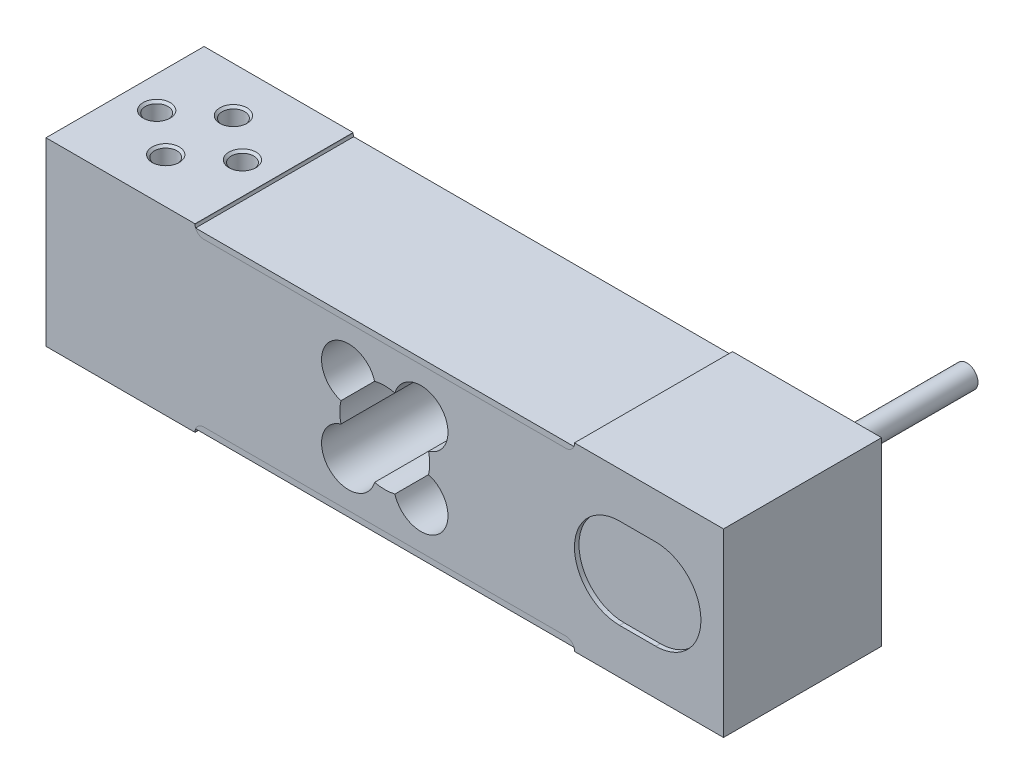
from build123d import *

# Parameters (mm, degrees)
EXTRUDE_1_DEPTH     = 17.5
EXTRUDE_2_DEPTH     = 35
EXTRUDE_2_2_DEPTH   = 35
CUT_EXTRUDE_1_DEPTH = 1
CHAMFER_2_SIZE      = 0.5
SKETCH1_R           = 2.5
BOSS_EXTRUDE1_DEPTH = 28


# Read off the part's stored shape, not the designer's step: M6 螺纹孔2
with BuildPart() as part:
    # 草图1 → 凸台-拉伸1 (new, symmetric)
    with BuildSketch(Plane.XY):
        with BuildLine():
            Line((-42, 20), (-42, 19.9))
            ThreePointArc((-42, 19.9), (-41.443502884, 18.556497116), (-40.1, 18))
            Line((-40.1, 18), (40.1, 18))
            ThreePointArc((40.1, 18), (41.443502884, 18.556497116), (42, 19.9))
            Line((42, 19.9), (42, 20))
            Line((42, 20), (75, 20))
            Line((75, 20), (75, -20))
            Line((75, -20), (42, -20))
            Line((42, -20), (42, -19.9))
            ThreePointArc((42, -19.9), (41.443502884, -18.556497116), (40.1, -18))
            Line((40.1, -18), (-40.1, -18))
            ThreePointArc((-40.1, -18), (-41.443502884, -18.556497116), (-42, -19.9))
            Line((-42, -19.9), (-42, -20))
            Line((-42, -20), (-75, -20))
            Line((-75, -20), (-75, 20))
            Line((-75, 20), (-42, 20))
        make_face()
        with BuildLine():
            ThreePointArc((2.244000503, 9.693655747), (0, 9.95), (-2.244000503, 9.693655747))
            ThreePointArc((-2.244000503, 9.693655747), (-12.242640687, 12.242640687), (-9.693655747, 2.244000503))
            ThreePointArc((-9.693655747, 2.244000503), (-9.95, 0), (-9.693655747, -2.244000503))
            ThreePointArc((-9.693655747, -2.244000503), (-12.242640687, -12.242640687), (-2.244000503, -9.693655747))
            ThreePointArc((-2.244000503, -9.693655747), (0, -9.95), (2.244000503, -9.693655747))
            ThreePointArc((2.244000503, -9.693655747), (12.242640687, -12.242640687), (9.693655747, -2.244000503))
            ThreePointArc((9.693655747, -2.244000503), (9.95, 0), (9.693655747, 2.244000503))
            ThreePointArc((9.693655747, 2.244000503), (12.242640687, 12.242640687), (2.244000503, 9.693655747))
        make_face(mode=Mode.SUBTRACT)
    extrude(amount=EXTRUDE_1_DEPTH, both=True)

    # 草图3 → 切除-拉伸1 (cut)
    with BuildSketch(Plane.XY.offset(17.5)):
        with BuildLine():
            Line((52, 10), (60, 10))
            ThreePointArc((60, 10), (70, 0), (60, -10))
            Line((60, -10), (52, -10))
            ThreePointArc((52, -10), (42, 0), (52, 10))
        make_face()
    extrude(amount=-CUT_EXTRUDE_1_DEPTH, mode=Mode.SUBTRACT)

    # M6 螺纹孔2 outline → M6 螺纹孔2 (revolve, cut)
    with BuildSketch(Plane(origin=(-58.5, 0, 7.5), x_dir=(1, 0, 0), z_dir=(0, 0, 1))):
        Polygon((0, 20), (0, -6.502151548), (2.5, -5), (2.5, 20), align=None)
    revolve(axis=Axis((-58.5, 0, 7.5), (0, 1, 0)), mode=Mode.SUBTRACT)

    # Hole Wizard M6 _2 2 outline → Hole Wizard M6 _2 2 (revolve, cut)
    with BuildSketch(Plane(origin=(-68, 0, 0), x_dir=(1, 0, 0), z_dir=(0, 0, 1))):
        Polygon((0, 20), (0, -6.502151548), (2.5, -5), (2.5, 20), align=None)
    revolve(axis=Axis((-68, 0, 0), (0, 1, 0)), mode=Mode.SUBTRACT)

    # Hole Wizard M6 _2 3 outline → Hole Wizard M6 _2 3 (revolve, cut)
    with BuildSketch(Plane(origin=(-58.5, 0, -7.5), x_dir=(1, 0, 0), z_dir=(0, 0, 1))):
        Polygon((0, 20), (0, -6.502151548), (2.5, -5), (2.5, 20), align=None)
    revolve(axis=Axis((-58.5, 0, -7.5), (0, 1, 0)), mode=Mode.SUBTRACT)

    # Hole Wizard M6 _2 4 outline → Hole Wizard M6 _2 4 (revolve, cut)
    with BuildSketch(Plane(origin=(-49, 0, 0), x_dir=(1, 0, 0), z_dir=(0, 0, 1))):
        Polygon((0, 20), (0, -6.502151548), (2.5, -5), (2.5, 20), align=None)
    revolve(axis=Axis((-49, 0, 0), (0, 1, 0)), mode=Mode.SUBTRACT)

    # Hole Wizard M6 _2 5 outline → Hole Wizard M6 _2 5 (revolve, cut)
    with BuildSketch(Plane(origin=(68, 0, 0), x_dir=(1, 0, 0), z_dir=(0, 0, 1))):
        Polygon((2.5, 5), (0, 6.502151548), (0, -20), (2.5, -20), align=None)
    revolve(axis=Axis((68, 0, 0), (0, 1, 0)), mode=Mode.SUBTRACT)

    # Hole Wizard M6 _2 6 outline → Hole Wizard M6 _2 6 (revolve, cut)
    with BuildSketch(Plane(origin=(58.5, 0, 7.5), x_dir=(1, 0, 0), z_dir=(0, 0, 1))):
        Polygon((2.5, 5), (0, 6.502151548), (0, -20), (2.5, -20), align=None)
    revolve(axis=Axis((58.5, 0, 7.5), (0, 1, 0)), mode=Mode.SUBTRACT)

    # Hole Wizard M6 _2 7 outline → Hole Wizard M6 _2 7 (revolve, cut)
    with BuildSketch(Plane(origin=(58.5, 0, -7.5), x_dir=(1, 0, 0), z_dir=(0, 0, 1))):
        Polygon((2.5, 5), (0, 6.502151548), (0, -20), (2.5, -20), align=None)
    revolve(axis=Axis((58.5, 0, -7.5), (0, 1, 0)), mode=Mode.SUBTRACT)

    # Hole Wizard M6 _2 8 outline → Hole Wizard M6 _2 8 (revolve, cut)
    with BuildSketch(Plane(origin=(49, 0, 0), x_dir=(1, 0, 0), z_dir=(0, 0, 1))):
        Polygon((2.5, 5), (0, 6.502151548), (0, -20), (2.5, -20), align=None)
    revolve(axis=Axis((49, 0, 0), (0, 1, 0)), mode=Mode.SUBTRACT)

    # 倒角2
    chamfer_2_edges = [part.edges().sort_by_distance(p)[0] for p in [
        (65.5, -20, 0),
        (56, -20, 7.5),
        (56, -20, -7.5),
        (46.5, -20, 0),
        (-61, 20, 7.5),
        (-70.5, 20, 0),
        (-61, 20, -7.5),
        (-51.5, 20, 0),
    ]]
    chamfer(chamfer_2_edges, length=CHAMFER_2_SIZE)

    # Sketch1 → Boss-Extrude1 (add)
    with BuildSketch(Plane(origin=(0, 0, -17.5), x_dir=(-1, 0, 0), z_dir=(0, 0, -1))):
        with Locations((-65.847321135, 13.266006363)):
            Circle(SKETCH1_R)
    extrude(amount=BOSS_EXTRUDE1_DEPTH)


with BuildPart() as body_2:
    # 草图2 → 凸台-拉伸2 (new body)
    with BuildSketch(Plane.XY.offset(17.5)):
        with BuildLine():
            Line((-41.885357107, 19.25), (41.885357107, 19.25))
            ThreePointArc((41.885357107, 19.25), (41.189724736, 18.343561758), (40.1, 18))
            Line((40.1, 18), (-40.1, 18))
            ThreePointArc((-40.1, 18), (-41.189724736, 18.343561758), (-41.885357107, 19.25))
        make_face()
    extrude(amount=-EXTRUDE_2_DEPTH)


with BuildPart() as body_3:
    # 草图2 → Extrude 2 2 (new body)
    with BuildSketch(Plane.XY.offset(17.5)):
        with BuildLine():
            Line((-41.885357107, -19.25), (41.885357107, -19.25))
            ThreePointArc((41.885357107, -19.25), (41.189724736, -18.343561758), (40.1, -18))
            Line((40.1, -18), (-40.1, -18))
            ThreePointArc((-40.1, -18), (-41.189724736, -18.343561758), (-41.885357107, -19.25))
        make_face()
    extrude(amount=-EXTRUDE_2_2_DEPTH)


solid = Compound([part.part, body_2.part, body_3.part])
